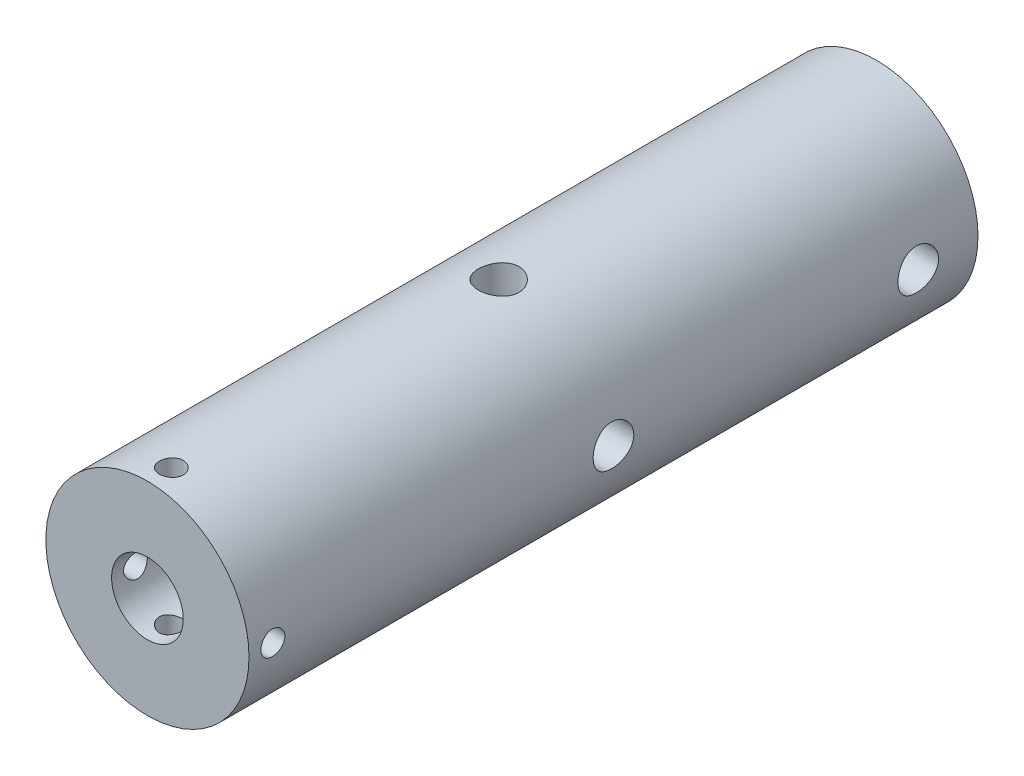
from build123d import *

# Parameters (mm, degrees)
SKETCH1_R               = 8.5
BOSS_EXTRUDE1_DEPTH     = 61
SKETCH9_R               = 1.7
CUT_EXTRUDE2_DEPTH      = 6.7
SKETCH10_R              = 1
CUT_EXTRUDE3_DEPTH      = 8.7
CIRPATTERN1_COUNT       = 4
SKETCH11_R              = 1.7
CUT_EXTRUDE4_DEPTH      = 8.7
CUT_EXTRUDE5_DEPTH      = 10
CUT_EXTRUDE5_DEPTH_BACK = 10
SKETCH12_R              = 1.7


with BuildPart() as part:
    # Sketch1 → Boss-Extrude1 (new body)
    with BuildSketch(Plane.XY):
        Circle(SKETCH1_R)
    extrude(amount=BOSS_EXTRUDE1_DEPTH)

    # Sketch7 → Cut-Revolve1 (revolve, cut)
    with BuildSketch(Plane(origin=(0, 0, 0), x_dir=(0, 0, -1), z_dir=(1, 0, 0))):
        Polygon((-61, 3), (-5, 3), (-1, 1.5), (0, 1.5), (0, 0), (-61, 0), align=None)
    revolve(axis=Axis((0, 0, 0), (0, 0, 1)), mode=Mode.SUBTRACT)

    # Sketch9 → Cut-Extrude2 (cut)
    with BuildSketch(Plane(origin=(8.5, 0, 0), x_dir=(0, 0, -1), z_dir=(1, 0, 0))):
        with Locations((-5, 0)):
            Circle(SKETCH9_R)
    extrude(amount=-CUT_EXTRUDE2_DEPTH, mode=Mode.SUBTRACT)

    # Sketch10 → Cut-Extrude3 (cut)
    with BuildSketch(Plane(origin=(0, 0, 0), x_dir=(0, 0, -1), z_dir=(1, 0, 0))):
        with Locations((-59, 0)):
            Circle(SKETCH10_R)
    cut_extrude3 = extrude(amount=-CUT_EXTRUDE3_DEPTH, mode=Mode.SUBTRACT)

    # CirPattern1: Cut-Extrude3 ×4 about axis
    cirpattern1_axis = Axis((0, 0, 61), (0, 0, 1))
    for i in range(1, CIRPATTERN1_COUNT):
        add(cut_extrude3.rotate(cirpattern1_axis, i * 360 / CIRPATTERN1_COUNT), mode=Mode.SUBTRACT)

    # Sketch11 → Cut-Extrude4 (cut)
    with BuildSketch(Plane(origin=(0, 8.5, 0), x_dir=(1, 0, 0), z_dir=(0, 1, 0))):
        with Locations((0, -31.611405642)):
            Circle(SKETCH11_R)
    extrude(amount=-CUT_EXTRUDE4_DEPTH, mode=Mode.SUBTRACT)

    # Sketch12 → Cut-Extrude5 (cut, two sides: drawn at the far end of the back side and taken through both)
    with BuildSketch(Plane(origin=(0, 0, 0), x_dir=(0, 0, -1), z_dir=(1, 0, 0)).offset(-CUT_EXTRUDE5_DEPTH_BACK)):
        with Locations((-30.5, 0)):
            Circle(SKETCH12_R)
    extrude(amount=CUT_EXTRUDE5_DEPTH + CUT_EXTRUDE5_DEPTH_BACK, mode=Mode.SUBTRACT)


solid = part.part
